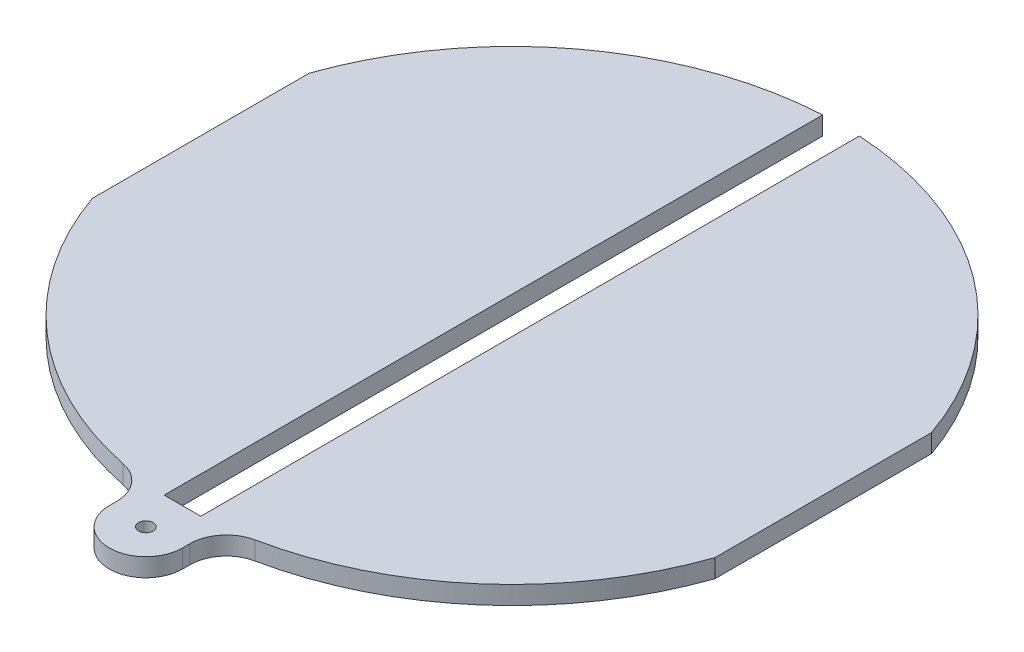
from build123d import *

# Parameters (mm, degrees)
BOSS_EXTRUDE1_DEPTH     = 3.175
SKETCH3_R               = 1.27
CUT_EXTRUDE1_DEPTH      = 86.84251205
CUT_EXTRUDE2_DEPTH      = 86.84251205
CUT_EXTRUDE2_DEPTH_BACK = 86.84251205
FILLET1_R               = 6.35


with BuildPart() as part:
    # Sketch2 → Boss-Extrude1 (new body)
    with BuildSketch(Plane(origin=(0, 0, 0), x_dir=(1, 0, 0), z_dir=(0, 1, 0))):
        with BuildLine():
            Line((3.175, 60.325), (53.975, 60.325))
            Line((53.975, 60.325), (53.975, -60.325))
            Line((53.975, -60.325), (6.35, -60.325))
            ThreePointArc((6.35, -60.325), (0, -66.675), (-6.35, -60.325))
            Line((-6.35, -60.325), (-53.975, -60.325))
            Line((-53.975, -60.325), (-53.975, 60.325))
            Line((-53.975, 60.325), (-3.175, 60.325))
            Line((-3.175, 60.325), (-3.175, -53.975))
            Line((-3.175, -53.975), (3.175, -53.975))
            Line((3.175, -53.975), (3.175, 60.325))
        make_face()
    extrude(amount=BOSS_EXTRUDE1_DEPTH)

    # Sketch3 → Cut-Extrude1 (cut, through all)
    with BuildSketch(Plane(origin=(0, 3.175, 0), x_dir=(1, 0, 0), z_dir=(0, 1, 0))):
        with Locations((0, -60.325)):
            Circle(SKETCH3_R)
    extrude(amount=-CUT_EXTRUDE1_DEPTH, mode=Mode.SUBTRACT)

    # Sketch4 → Cut-Extrude2 (cut, two sides: drawn at the far end of the back side and taken through both)
    with BuildSketch(Plane(origin=(0, 3.175, 0), x_dir=(1, 0, 0), z_dir=(0, 1, 0)).offset(-CUT_EXTRUDE2_DEPTH_BACK)):
        with BuildLine():
            Line((-53.975, -60.325), (-6.35, -60.325))
            Line((-6.35, -60.325), (-6.35, -53.621126628))
            ThreePointArc((-6.35, -53.621126628), (-35.651302063, -41.491622451), (-53.975, -15.608553311))
            Line((-53.975, -15.608553311), (-53.975, -60.325))
        make_face()
        with BuildLine():
            Line((53.975, -60.325), (53.975, -15.608553311))
            ThreePointArc((53.975, -15.608553311), (35.651302063, -41.491622451), (6.35, -53.621126628))
            Line((6.35, -53.621126628), (6.35, -60.325))
            Line((6.35, -60.325), (53.975, -60.325))
        make_face()
        with BuildLine():
            Line((-53.975, 60.325), (-53.975, 21.958553311))
            ThreePointArc((-53.975, 21.958553311), (-34.392375162, 48.818039236), (-3.175, 60.236737399))
            Line((-3.175, 60.236737399), (-3.175, 60.325))
            Line((-3.175, 60.325), (-53.975, 60.325))
        make_face()
        with BuildLine():
            Line((53.975, 60.325), (3.175, 60.325))
            Line((3.175, 60.325), (3.175, 60.236737399))
            ThreePointArc((3.175, 60.236737399), (34.392375162, 48.818039236), (53.975, 21.958553311))
            Line((53.975, 21.958553311), (53.975, 60.325))
        make_face()
    extrude(amount=CUT_EXTRUDE2_DEPTH + CUT_EXTRUDE2_DEPTH_BACK, mode=Mode.SUBTRACT)

    # Fillet1
    fillet1_edges = [part.edges().sort_by_distance(p)[0] for p in [
        (6.35, 1.5875, 53.621126628),
        (-6.35, 1.5875, 53.621126628),
    ]]
    fillet(fillet1_edges, radius=FILLET1_R)


solid = part.part
